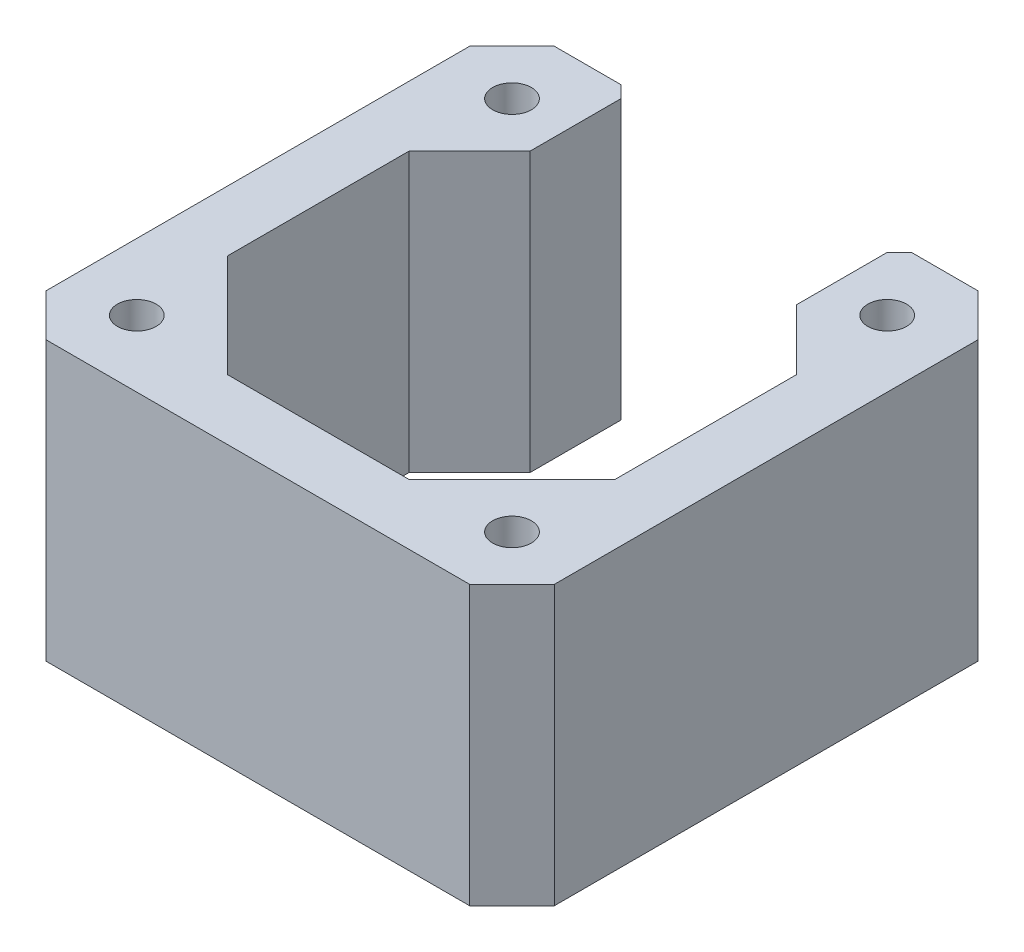
from build123d import *

# Parameters (mm, degrees)
BASE_DEPTH      = 23
BASE_DEPTH_BACK = 0.0001
SKETCH1_R       = 1.6


with BuildPart() as part:
    # Sketch1 → Base (new, two sides: drawn at the far end of the back side and taken through both)
    with BuildSketch(Plane(origin=(0, 0, 0), x_dir=(1, 0, 0), z_dir=(0, 1, 0)).offset(-BASE_DEPTH_BACK)):
        Polygon((-16, -7.499999998), (-7.5, -15.999999998), (7.5, -15.999999998), (16, -7.499999998), (16, 7.500000002), (11, 12.500000002), (11, 20.000000005), (12, 21.000000005), (17.500000004, 21.000000005), (21, 17.500000009), (21, -17.499999998), (17.5, -20.999999998), (-17.5, -20.999999998), (-21, -17.499999998), (-21, 17.500000009), (-17.500000004, 21.000000005), (-12, 21.000000005), (-11, 20.000000005), (-11, 12.500000002), (-16, 7.500000002), align=None)
        with Locations((-15.500000002, 15.5)):
            Circle(SKETCH1_R, mode=Mode.SUBTRACT)
        with Locations((-15.500000002, -15.5)):
            Circle(SKETCH1_R, mode=Mode.SUBTRACT)
        with Locations((15.500000002, -15.5)):
            Circle(SKETCH1_R, mode=Mode.SUBTRACT)
        with Locations((15.500000002, 15.5)):
            Circle(SKETCH1_R, mode=Mode.SUBTRACT)
    extrude(amount=BASE_DEPTH + BASE_DEPTH_BACK)


solid = part.part
